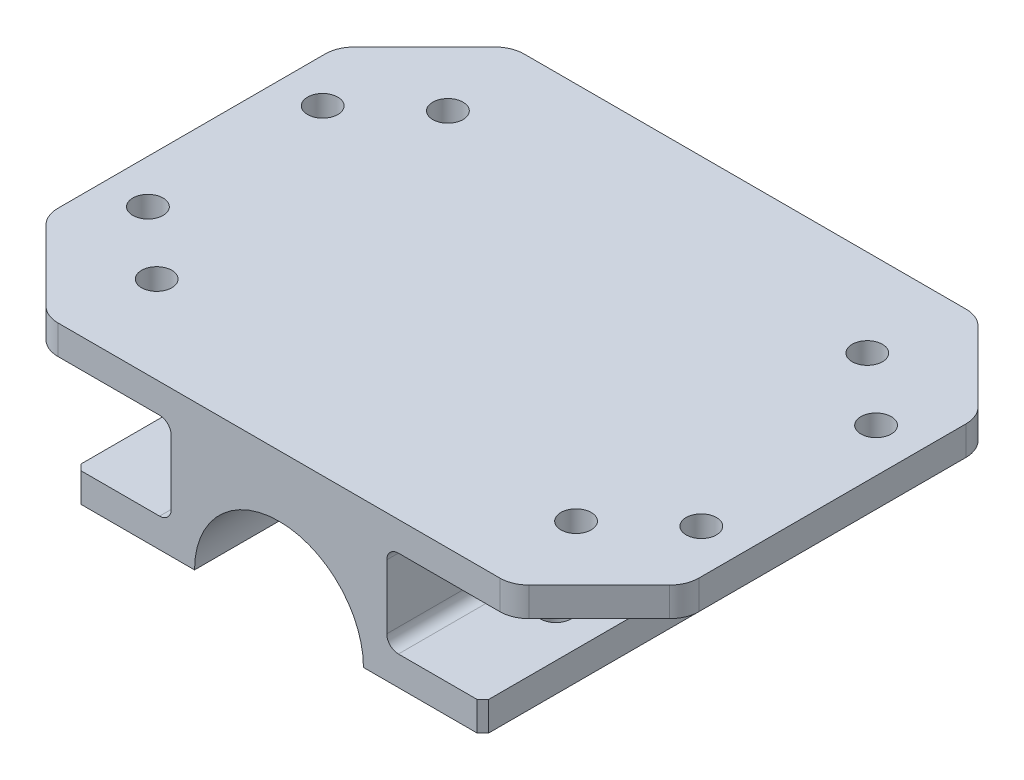
from build123d import *

# Parameters (mm, degrees)
EXTRUDE_2_DEPTH     = 40
SKETCH_3_R          = 2.6
CUT_EXTRUDE_2_DEPTH = 20
CHAMFER_2_SIZE      = 1
SKETCH_4_R          = 2.6
CUT_EXTRUDE_3_DEPTH = 10
SKETCH_5_R          = 2.6
CUT_EXTRUDE_4_DEPTH = 10
CHAMFER_3_SIZE      = 15
FILLET_2_R          = 5
SKETCH1_W           = 4
SKETCH1_H           = 15
CUT_EXTRUDE1_DEPTH  = 101.249688279
FILLET1_R           = 2


with BuildPart() as part:
    # 草图2 → 凸台-拉伸2 (new, symmetric)
    with BuildSketch(Plane.XY):
        with BuildLine():
            Line((25, 0), (14.5, 0))
            ThreePointArc((14.5, 0), (0, 14.5), (-14.5, 0))
            Line((-14.5, 0), (-25, 0))
            Line((-25, 0), (-35, 0))
            Line((-35, 0), (-35, 5))
            Line((-35, 5), (-22.5, 5))
            Line((-22.5, 5), (-22.5, 20))
            Line((-22.5, 20), (-35, 20))
            Line((-35, 20), (-55, 20))
            Line((-55, 20), (-55, 25))
            Line((-55, 25), (-35, 25))
            Line((-35, 25), (35, 25))
            Line((35, 25), (55, 25))
            Line((55, 25), (55, 20))
            Line((55, 20), (35, 20))
            Line((35, 20), (22.5, 20))
            Line((22.5, 20), (22.5, 5))
            Line((22.5, 5), (35, 5))
            Line((35, 5), (35, 0))
            Line((35, 0), (25, 0))
        make_face()
    extrude(amount=EXTRUDE_2_DEPTH, both=True)

    # 草图3 → 切除-拉伸2 (cut)
    with BuildSketch(Plane.XZ.offset(-20)):
        with Locations((-27.5, 20)):
            Circle(SKETCH_3_R)
        with Locations((27.5, 20)):
            Circle(SKETCH_3_R)
        with Locations((27.5, -20)):
            Circle(SKETCH_3_R)
        with Locations((-27.5, -20)):
            Circle(SKETCH_3_R)
    extrude(amount=CUT_EXTRUDE_2_DEPTH, mode=Mode.SUBTRACT)

    # 倒角2
    chamfer_2_edges = [part.edges().sort_by_distance(p)[0] for p in [
        (-35, 2.5, 40),
        (35, 2.5, 40),
        (-35, 2.5, -40),
        (35, 2.5, -40),
    ]]
    chamfer(chamfer_2_edges, length=CHAMFER_2_SIZE)

    # 草图4 → 切除-拉伸3 (cut)
    with BuildSketch(Plane(origin=(0, 25, 0), x_dir=(1, 0, 0), z_dir=(0, 1, 0))):
        with Locations((36, -25)):
            Circle(SKETCH_4_R)
        with Locations((-36, -25)):
            Circle(SKETCH_4_R)
        with Locations((36, 25)):
            Circle(SKETCH_4_R)
        with Locations((-36, 25)):
            Circle(SKETCH_4_R)
    extrude(amount=-CUT_EXTRUDE_3_DEPTH, mode=Mode.SUBTRACT)

    # 草图5 → 切除-拉伸4 (cut)
    with BuildSketch(Plane(origin=(0, 25, 0), x_dir=(1, 0, 0), z_dir=(0, 1, 0))):
        with Locations((-47.5, 15)):
            Circle(SKETCH_5_R)
        with Locations((47.5, 15)):
            Circle(SKETCH_5_R)
        with Locations((47.5, -15)):
            Circle(SKETCH_5_R)
        with Locations((-47.5, -15)):
            Circle(SKETCH_5_R)
    extrude(amount=-CUT_EXTRUDE_4_DEPTH, mode=Mode.SUBTRACT)

    # 倒角3
    chamfer_3_edges = [part.edges().sort_by_distance(p)[0] for p in [
        (55, 22.5, -40),
        (55, 22.5, 40),
        (-55, 22.5, -40),
        (-55, 22.5, 40),
    ]]
    chamfer(chamfer_3_edges, length=CHAMFER_3_SIZE)

    # 圆角2
    fillet_2_edges = [part.edges().sort_by_distance(p)[0] for p in [
        (-55, 22.5, -25),
        (-40, 22.5, -40),
        (40, 22.5, -40),
        (55, 22.5, -25),
        (55, 22.5, 25),
        (40, 22.5, 40),
        (-40, 22.5, 40),
        (-55, 22.5, 25),
    ]]
    fillet(fillet_2_edges, radius=FILLET_2_R)

    # Sketch1 → Cut-Extrude1 (cut, through all)
    with BuildSketch(Plane.XY.offset(40)):
        with Locations((-20.5, 12.5)):
            Rectangle(SKETCH1_W, SKETCH1_H)
        with Locations((20.5, 12.5)):
            Rectangle(SKETCH1_W, SKETCH1_H)
    extrude(amount=-CUT_EXTRUDE1_DEPTH, mode=Mode.SUBTRACT)

    # Fillet1
    fillet1_edges = [part.edges().sort_by_distance(p)[0] for p in [
        (18.5, 20, 0),
        (18.5, 5, 0),
        (-18.5, 20, 0),
        (-18.5, 5, 0),
    ]]
    fillet(fillet1_edges, radius=FILLET1_R)


solid = part.part
